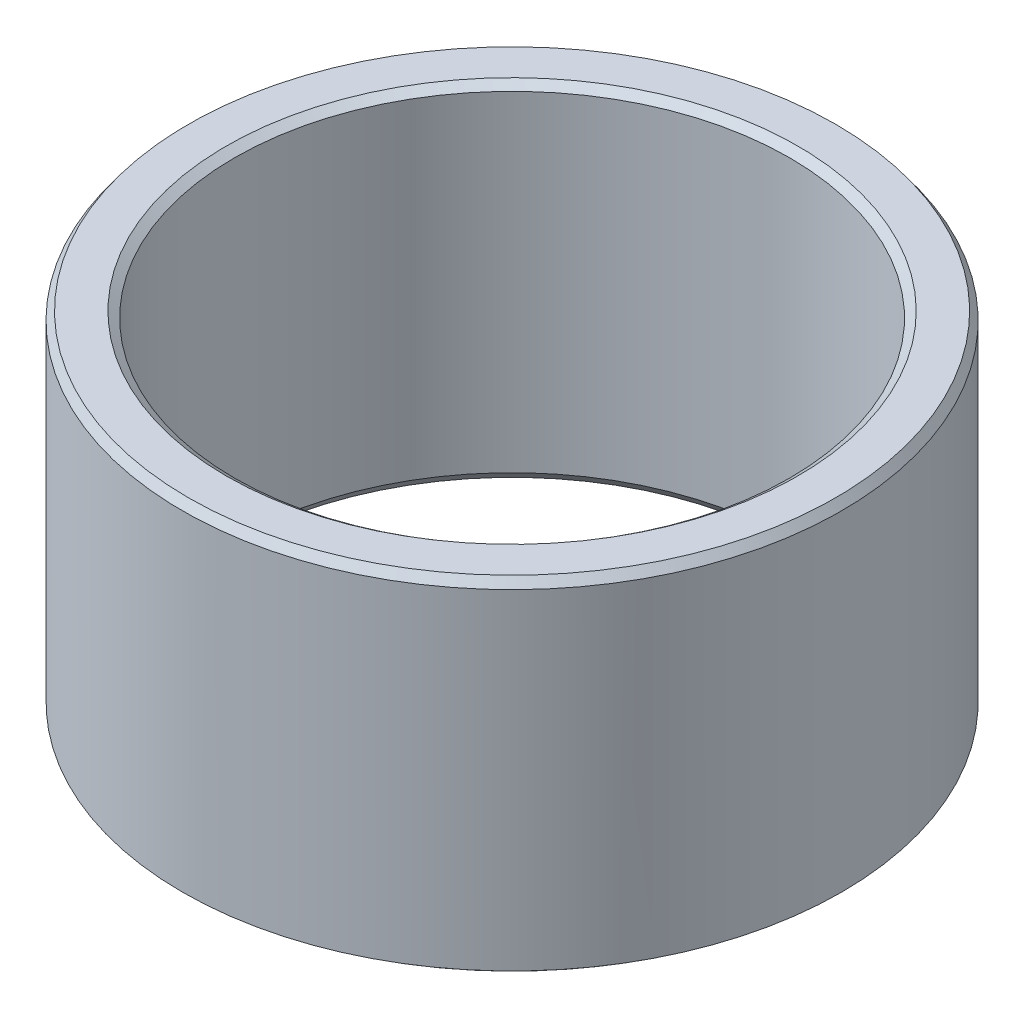
from build123d import *
from OCP.BRepFilletAPI import BRepFilletAPI_MakeChamfer

# Parameters (mm, degrees)
SKETCH1_R           = 22.5
BOSS_EXTRUDE1_DEPTH = 23.521555114
SKETCH2_R           = 18.946115209
CUT_EXTRUDE1_DEPTH  = 40.569730287
CHAMFER1_SIZE       = 0.565260912
CHAMFER1_SIZE2      = 0.40943689


with BuildPart() as part:
    # Sketch1 → Boss-Extrude1 (new body)
    with BuildSketch(Plane(origin=(0, 0, 0), x_dir=(1, 0, 0), z_dir=(0, 1, 0))):
        Circle(SKETCH1_R)
    extrude(amount=BOSS_EXTRUDE1_DEPTH)

    # Sketch2 → Cut-Extrude1 (cut, through all)
    with BuildSketch(Plane(origin=(0, 0, 0), x_dir=(1, 0, 0), z_dir=(0, 1, 0))):
        Circle(SKETCH2_R)
    extrude(amount=CUT_EXTRUDE1_DEPTH, mode=Mode.SUBTRACT)

    # Chamfer1: one chamfer whose edges measure the first distance from different faces: ONE call of the kernel's chamfer builder (chamfer() names one face for all edges)
    chamfer1_edges_1 = [part.edges().sort_by_distance(p)[0] for p in [
        (-18.946115209, 23.521555114, 0),
    ]]
    chamfer1_side_1 = [part.faces().sort_by_distance(p)[0] for p in [
        (-21.863603897, 23.521555114, 0),
    ]]
    chamfer1_edges_2 = [part.edges().sort_by_distance(p)[0] for p in [
        (-18.946115209, 0, 0),
    ]]
    chamfer1_side_2 = [part.faces().sort_by_distance(p)[0] for p in [
        (-18.946115209, 11.760777557, 0),
    ]]
    chamfer1_edges_3 = [part.edges().sort_by_distance(p)[0] for p in [
        (-22.5, 0, 0),
    ]]
    chamfer1_side_3 = [part.faces().sort_by_distance(p)[0] for p in [
        (-21.863603897, 0, 0),
    ]]
    chamfer1_edges_4 = [part.edges().sort_by_distance(p)[0] for p in [
        (-22.5, 23.521555114, 0),
    ]]
    chamfer1_side_4 = [part.faces().sort_by_distance(p)[0] for p in [
        (-22.5, 11.760777557, 0),
    ]]
    chamfer1 = BRepFilletAPI_MakeChamfer(part.part.solid().wrapped)
    for e in chamfer1_edges_1:
        chamfer1.Add(CHAMFER1_SIZE, CHAMFER1_SIZE2, e.wrapped, chamfer1_side_1[0].wrapped)  # the first distance lies on this face
    for e in chamfer1_edges_2:
        chamfer1.Add(CHAMFER1_SIZE, CHAMFER1_SIZE2, e.wrapped, chamfer1_side_2[0].wrapped)  # the first distance lies on this face
    for e in chamfer1_edges_3:
        chamfer1.Add(CHAMFER1_SIZE, CHAMFER1_SIZE2, e.wrapped, chamfer1_side_3[0].wrapped)  # the first distance lies on this face
    for e in chamfer1_edges_4:
        chamfer1.Add(CHAMFER1_SIZE, CHAMFER1_SIZE2, e.wrapped, chamfer1_side_4[0].wrapped)  # the first distance lies on this face
    add(Compound.cast(chamfer1.Shape()), mode=Mode.REPLACE)


solid = part.part
